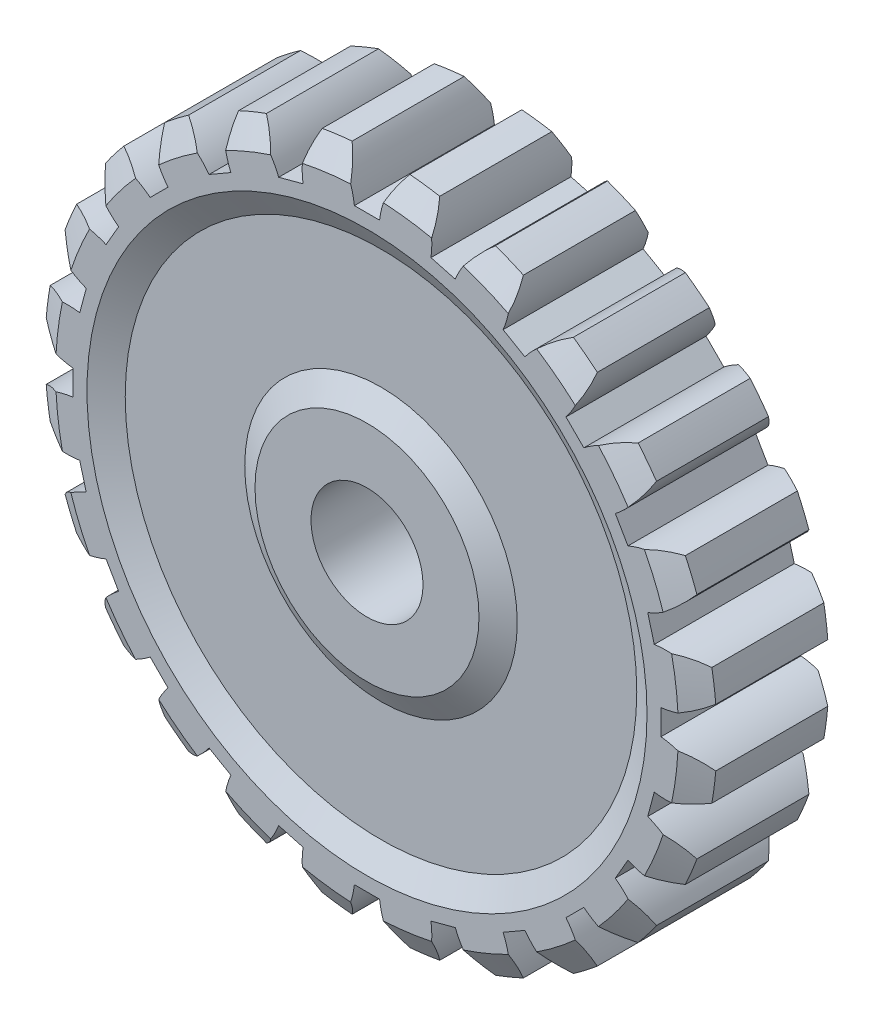
from build123d import *

# Parameters (mm, degrees)
SKETCH1_R           = 76.2
BOSS_EXTRUDE1_DEPTH = 15.875
SKETCH2_R           = 12.7
CUT_EXTRUDE1_DEPTH  = 109.92610167
SKETCH3_R           = 63.5
SKETCH3_R_2         = 25.4
CUT_EXTRUDE3_DEPTH  = 3.175
CUT_EXTRUDE3_DRAFT  = -60
CUT_EXTRUDE4_DEPTH  = 109.92610167
CIRPATTERN1_COUNT   = 24


with BuildPart() as part:
    # Sketch1 → Boss-Extrude1 (new body)
    with BuildSketch(Plane.XY):
        Circle(SKETCH1_R)
    extrude(amount=BOSS_EXTRUDE1_DEPTH)

    # Sketch2 → Cut-Extrude1 (cut, through all)
    with BuildSketch(Plane.XY.offset(15.875)):
        Circle(SKETCH2_R)
    extrude(amount=-CUT_EXTRUDE1_DEPTH, mode=Mode.SUBTRACT)


with BuildPart() as cut_extrude3_tool:
    # Sketch3 → Cut-Extrude3 (with draft: the straight prism first)
    with BuildSketch(Plane.XY.offset(15.875)):
        Circle(SKETCH3_R)
        Circle(SKETCH3_R_2, mode=Mode.SUBTRACT)
    extrude(amount=-CUT_EXTRUDE3_DEPTH)
    # Cut-Extrude3: the draft: its side faces are tilted about the plane it starts from
    cut_extrude3_sides = [cut_extrude3_tool.faces().sort_by_distance(p)[0] for p in [
        (-63.5, 0, 14.2875),
        (-25.4, 0, 14.2875),
    ]]
    draft(cut_extrude3_sides, Plane.XY.offset(15.875), CUT_EXTRUDE3_DRAFT)


with BuildPart() as part_1:
    add(part.part)

    # Cut-Extrude3: cut by cut_extrude3_tool
    add(cut_extrude3_tool.part, mode=Mode.SUBTRACT)

    # Chamfer2: read off the stored shape, not the designer's step
    # Chamfer2 outline → Chamfer2 (revolve, cut)
    with BuildSketch(Plane.XZ):
        Polygon((76.2, 15.875), (70.612, 15.875), (76.2, 12.7), align=None)
    revolve(axis=Axis((0, 0, 0), (0, 0, 1)), mode=Mode.SUBTRACT)

    # Sketch4 → Cut-Extrude4 (cut, through all)
    with BuildSketch(Plane.XY.offset(15.875)):
        with BuildLine():
            Line((-66.675, -2.8575), (-66.675, 2.8575))
            ThreePointArc((-66.675, 2.8575), (-71.541608863, 4.084797701), (-75.91878463, 6.5405))
            ThreePointArc((-75.91878463, 6.5405), (-76.2, 0), (-75.91878463, -6.5405))
            ThreePointArc((-75.91878463, -6.5405), (-71.541608863, -4.084797701), (-66.675, -2.8575))
        make_face()
    cut_extrude4 = extrude(amount=-CUT_EXTRUDE4_DEPTH, mode=Mode.SUBTRACT)

    # CirPattern1: Cut-Extrude4 ×24 about axis
    cirpattern1_axis = Axis((0, 0, 0), (0, 0, 1))
    for i in range(1, CIRPATTERN1_COUNT):
        add(cut_extrude4.rotate(cirpattern1_axis, i * 360 / CIRPATTERN1_COUNT), mode=Mode.SUBTRACT)

    # Mirror2: part across plane


with BuildPart() as part_2:
    add(part_1.part)
    add(part_1.part.mirror(Plane.XY))


solid = part_2.part
